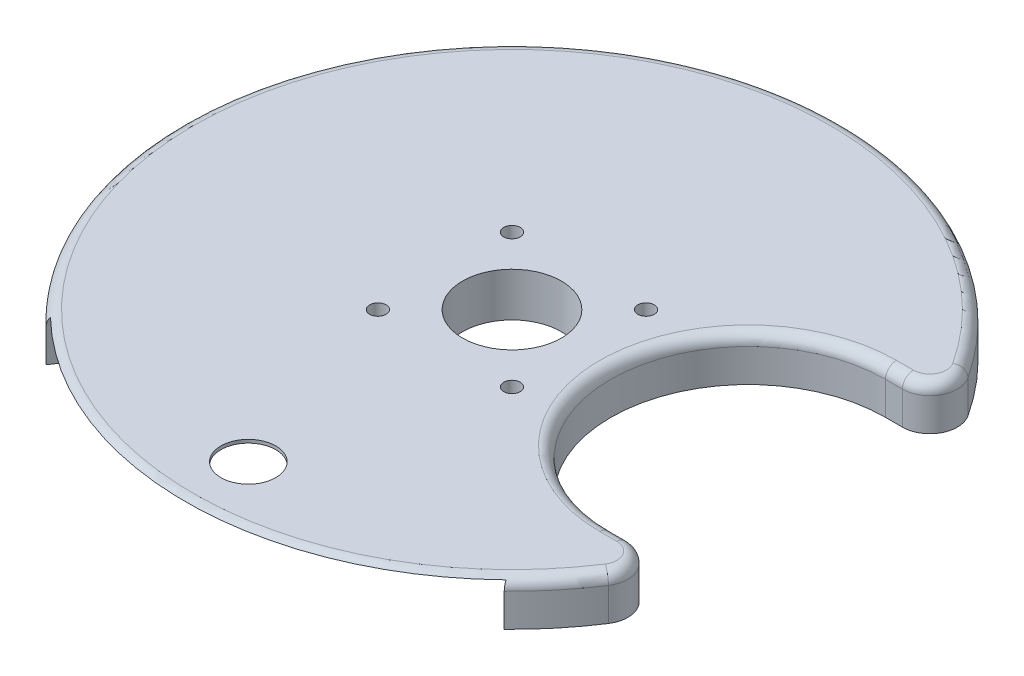
from build123d import *

# Parameters (mm, degrees)
SKETCH1_R           = 6.35
SKETCH1_R_2         = 1.905
SKETCH1_R_3         = 11.43
BOSS_EXTRUDE1_DEPTH = 10.16
SKETCH8_R           = 6.35
CUT_EXTRUDE3_DEPTH  = 9.398
FILLET1_R           = 6.35
FILLET3_R           = 2.54


with BuildPart() as part:
    # Sketch1 → Boss-Extrude1 (new body)
    with BuildSketch(Plane(origin=(0, 0, 0), x_dir=(1, 0, 0), z_dir=(0, 1, 0))):
        with BuildLine():
            ThreePointArc((54.61, -31.75), (22.86, 0), (54.61, 31.75))
            Line((54.61, 31.75), (69.270321928, 31.75))
            ThreePointArc((69.270321928, 31.75), (-76.2, 0), (69.270321928, -31.75))
            Line((69.270321928, -31.75), (54.61, -31.75))
        make_face()
        with Locations(Location((0, -60.96, 0), (0, 0, 270))):
            Circle(SKETCH1_R, mode=Mode.SUBTRACT)
        with Locations(Location((-15.499999988, -15.499999988, 0), (0, 0, 270))):
            Circle(SKETCH1_R_2, mode=Mode.SUBTRACT)
        with Locations(Location((15.499999988, -15.499999988, 0), (0, 0, 270))):
            Circle(SKETCH1_R_2, mode=Mode.SUBTRACT)
        with Locations(Location((-15.499999988, 15.499999988, 0), (0, 0, 270))):
            Circle(SKETCH1_R_2, mode=Mode.SUBTRACT)
        with Locations(Location((0, 0, 0), (0, 0, 270))):
            Circle(SKETCH1_R_3, mode=Mode.SUBTRACT)
        with Locations(Location((15.499999988, 15.499999988, 0), (0, 0, 270))):
            Circle(SKETCH1_R_2, mode=Mode.SUBTRACT)
    extrude(amount=BOSS_EXTRUDE1_DEPTH)

    # Sketch8 → Cut-Extrude3 (cut)
    with BuildSketch(Plane.XZ):
        with BuildLine():
            add(Edge.make_bspline(
                [(27.167528595, 25.920303401), (12.984356547, 19.050000027), (1.04e-07, 19.05)],
                knots=[0, 0, 0, 0.304865692, 0.304865692, 0.304865692], degree=2))
            ThreePointArc((27.167528595, 25.920303401), (42.590415369, 38.092533294), (52.979467942, 54.76875))
            ThreePointArc((52.979467942, 54.76875), (0, 76.2), (-52.979467942, 54.76875))
            add(Edge.make_bspline(
                [(1.04e-07, 19.05), (-29.606058837, 19.049999938), (-52.979467942, 54.76875)],
                knots=[0.304865692, 0.304865692, 0.304865692, 1, 1, 1], degree=2))
        make_face()
        with Locations(Location((0, 60.96, 0), (0, 0, 270))):
            Circle(SKETCH8_R, mode=Mode.SUBTRACT)
    extrude(amount=-CUT_EXTRUDE3_DEPTH, mode=Mode.SUBTRACT)

    # Fillet1
    fillet1_edges = [part.edges().sort_by_distance(p)[0] for p in [
        (69.270321928, 5.08, -31.75),
        (69.270321928, 5.08, 31.75),
    ]]
    fillet(fillet1_edges, radius=FILLET1_R)

    # Fillet3
    # the kernel refuses this fillet: 2.54 mm, written as the material it takes off along each edge
    with BuildSketch(Plane(origin=(54.61, 10.16, -31.75), x_dir=(0, 0, -1), z_dir=(1, 0, 0))) as fillet3_piece_1:
        with BuildLine():
            CenterArc((FILLET3_R, -FILLET3_R), FILLET3_R, 90, 90)
            Line((0, -FILLET3_R), (0, 0))
            Line((0, 0), (FILLET3_R, 0))
        make_face()
    extrude(amount=3.934107304, mode=Mode.SUBTRACT)
    with BuildSketch(Plane(origin=(58.544107304, 10.16, -38.1), x_dir=(0, 0, 1), z_dir=(-1, 0, 0))) as fillet3_piece_2:
        with BuildLine():
            CenterArc((6.35 - FILLET3_R, -FILLET3_R), FILLET3_R, 0, 90)
            Line((6.35, -FILLET3_R), (6.35, 0))
            Line((6.35, 0), (6.35 - FILLET3_R, 0))
        make_face()
    revolve(axis=Axis((58.544107304, 10.16, -38.1), (0, 1, 0)), revolution_arc=123.055731151, mode=Mode.SUBTRACT)
    with BuildSketch(Plane(origin=(0, 10.16, 0), x_dir=(0.8381404052084442, 0, -0.5454545454545454), z_dir=(0.5454545454545454, 0, 0.8381404052084442))) as fillet3_piece_3:
        with BuildLine():
            CenterArc((76.2 - FILLET3_R, -FILLET3_R), FILLET3_R, 0, 90)
            Line((76.2, -FILLET3_R), (76.2, 0))
            Line((76.2, 0), (76.2 - FILLET3_R, 0))
        make_face()
    revolve(axis=Axis((0, 10.16, 0), (0, 1, 0)), revolution_arc=293.888537698, mode=Mode.SUBTRACT)
    with BuildSketch(Plane(origin=(58.544107304, 10.16, 38.1), x_dir=(0, 0, -1), z_dir=(-1, 0, 0))) as fillet3_piece_4:
        with BuildLine():
            CenterArc((6.35 - FILLET3_R, FILLET3_R), FILLET3_R, 270, 90)
            Line((6.35 - FILLET3_R, 0), (6.35, 0))
            Line((6.35, 0), (6.35, FILLET3_R))
        make_face()
    revolve(axis=Axis((58.544107304, 10.16, 38.1), (0, -1, 0)), revolution_arc=123.055731151, mode=Mode.SUBTRACT)
    with BuildSketch(Plane(origin=(58.544107304, 10.16, 31.75), x_dir=(0, -1, 0), z_dir=(-1, 0, 0))) as fillet3_piece_5:
        with BuildLine():
            CenterArc((FILLET3_R, FILLET3_R), FILLET3_R, 180, 90)
            Line((0, FILLET3_R), (0, 0))
            Line((0, 0), (FILLET3_R, 0))
        make_face()
    extrude(amount=3.934107304, mode=Mode.SUBTRACT)
    with BuildSketch(Plane(origin=(54.61, 10.16, 0), x_dir=(0, 0, 1), z_dir=(1, 0, 0))) as fillet3_piece_6:
        with BuildLine():
            CenterArc((31.75 + FILLET3_R, FILLET3_R), FILLET3_R, 180, 90)
            Line((31.75 + FILLET3_R, 0), (31.75, 0))
            Line((31.75, 0), (31.75, FILLET3_R))
        make_face()
    revolve(axis=Axis((54.61, 10.16, 0), (0, -1, 0)), revolution_arc=180, mode=Mode.SUBTRACT)


solid = part.part
